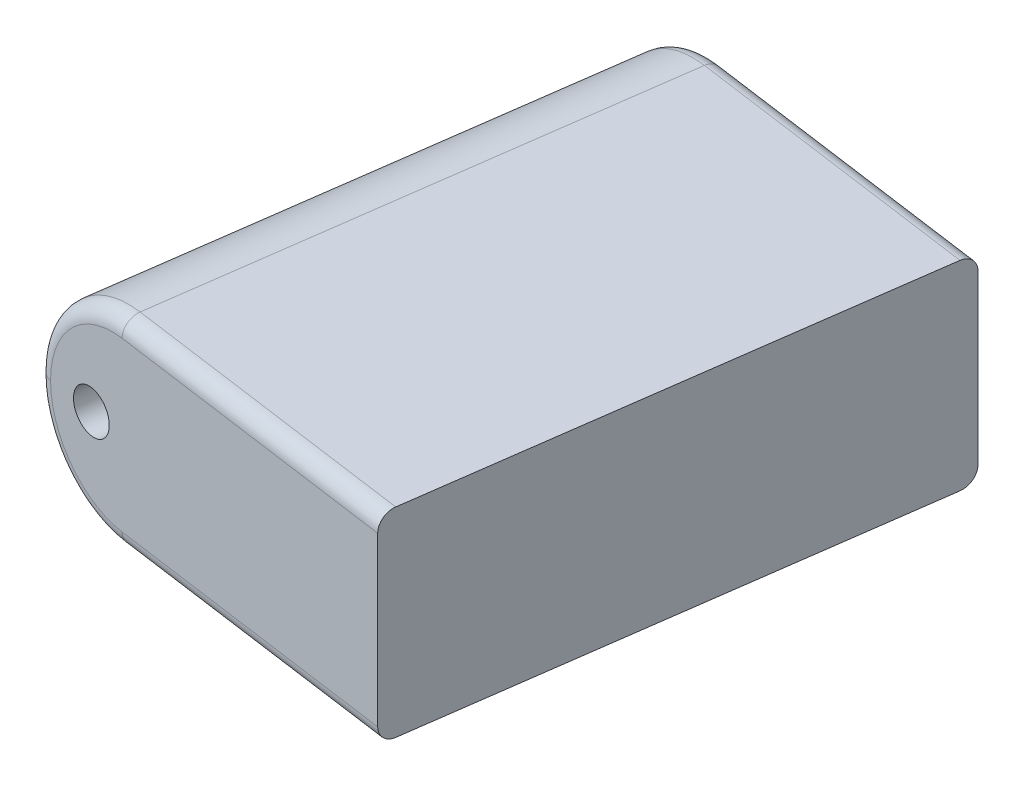
from build123d import *

# Parameters (mm, degrees)
BOSS_EXTRUDE1_DEPTH = 9.525
SKETCH3_R           = 2
CUT_EXTRUDE1_DEPTH  = 2.7
SKETCH4_R           = 1
CUT_EXTRUDE2_DEPTH  = 51.984772229
FILLET2_R           = 4.7625
FILLET3_R           = 0.762


with BuildPart() as part:
    # Sketch1 → Boss-Extrude1 (new body)
    with BuildSketch(Plane(origin=(0, 0, 0), x_dir=(1, 0, 0), z_dir=(0, 1, 0))):
        Polygon((-27.422743224, -19.119856123), (-46.29298428, -16.509012872), (-42.811859946, 8.651308536), (-23.941618889, 6.040465285), align=None)
    extrude(amount=BOSS_EXTRUDE1_DEPTH)

    # Sketch3 → Cut-Extrude1 (cut)
    with BuildSketch(Plane(origin=(0.316670388, 0, -2.684144047), x_dir=(-0.9905638349724136, 0, -0.13705213914691383), z_dir=(0.13705213914691383, 0, -0.9905638349724136))):
        with Locations((40.495544979, 4.7625)):
            Circle(SKETCH3_R)
    extrude(amount=-CUT_EXTRUDE1_DEPTH, mode=Mode.SUBTRACT)

    # Sketch4 → Cut-Extrude2 (cut, through all)
    with BuildSketch(Plane(origin=(0.000303759, 0, -0.00219546), x_dir=(-0.9905638349724136, 0, -0.13705213914691383), z_dir=(0.1370521391469138, 0, -0.9905638349724135))):
        with Locations((40.549730429, 4.7625)):
            Circle(SKETCH4_R)
    extrude(amount=-CUT_EXTRUDE2_DEPTH, mode=Mode.SUBTRACT)

    # Fillet2
    fillet2_edges = [part.edges().sort_by_distance(p)[0] for p in [
        (-44.552422113, 0, 3.928852168),
        (-44.552422113, 9.525, 3.928852168),
    ]]
    fillet(fillet2_edges, radius=FILLET2_R - 0.0001)  # a hair under: the kernel refuses the full size

    # Fillet3
    fillet3_edges = [part.edges().sort_by_distance(p)[0] for p in [
        (-34.499133148, 9.525, 18.140783052),
        (-34.499133148, 0, 18.140783052),
        (-44.911271882, 1.394874665, 16.700183429),
        (-44.911271882, 8.130125335, 16.700183429),
        (-41.430147548, 1.394874665, -8.460137979),
        (-41.430147548, 8.130125335, -8.460137979),
        (-31.018008814, 0, -7.019538357),
        (-31.018008814, 9.525, -7.019538357),
    ]]
    fillet(fillet3_edges, radius=FILLET3_R)


solid = part.part
